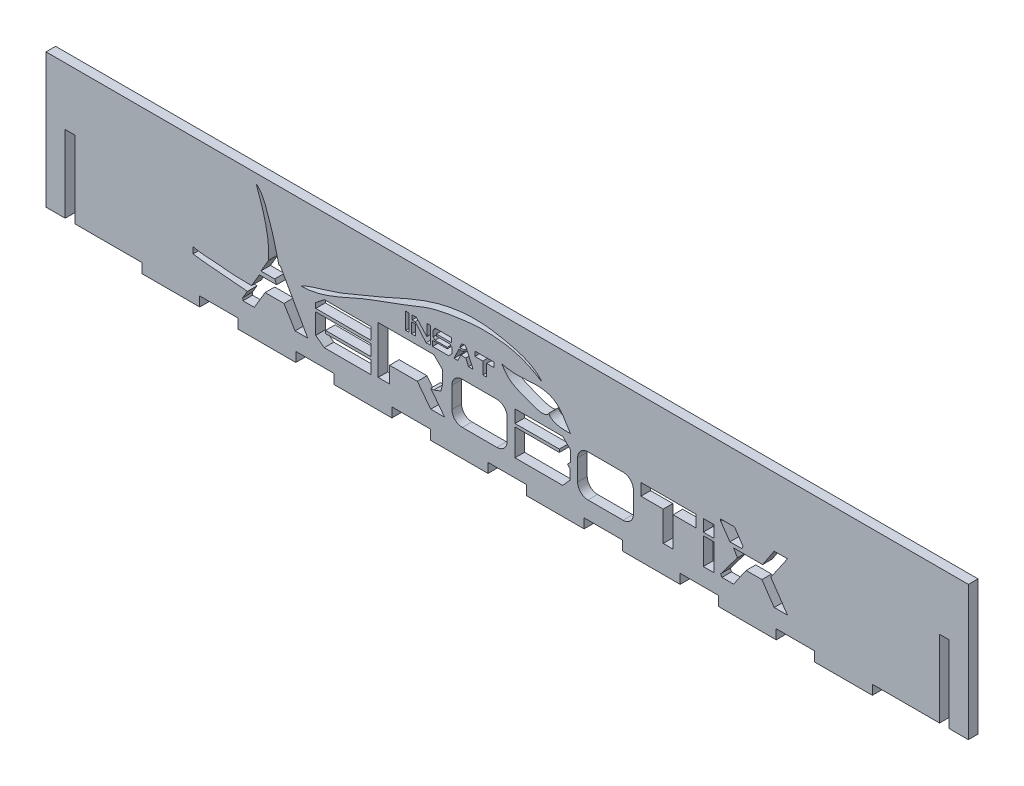
from build123d import *

# Parameters (mm, degrees)
SKETCH1_W           = 5.465631802
SKETCH1_H           = 13.937676678
SKETCH1_H_2         = 6.195408131
SKETCH1_W_2         = 2.126575518
SKETCH1_H_3         = 5.478126352
SKETCH1_W_3         = 1.826673842
SKETCH1_H_4         = 8.695253417
BOSS_EXTRUDE1_DEPTH = 5


with BuildPart() as part:
    # Sketch1 → Boss-Extrude1 (new body)
    with BuildSketch(Plane.XY):
        Polygon((-5.246535477, -61.546798422), (14.753464523, -61.546798422), (14.753464523, -66.546798422), (44.753464523, -66.546798422), (44.753464523, -61.546798422), (79.753464523, -61.546798422), (79.753464523, -21.546798422), (84.753464523, -21.546798422), (84.753464523, -61.546798422), (94.753464523, -61.546798422), (94.753464523, 8.453201578), (43.214989523, 8.453201578), (-333.708060477, 8.453201578), (-385.246535477, 8.453201578), (-385.246535477, -61.546798422), (-375.246535477, -61.546798422), (-375.246535477, -21.546798422), (-370.246535477, -21.546798422), (-370.246535477, -61.546798422), (-335.246535477, -61.546798422), (-335.246535477, -66.546798422), (-305.246535477, -66.546798422), (-305.246535477, -61.546798422), (-285.246535477, -61.546798422), (-285.246535477, -66.546798422), (-255.246535477, -66.546798422), (-255.246535477, -61.546798422), (-235.246535477, -61.546798422), (-235.246535477, -66.546798422), (-205.246535477, -66.546798422), (-205.246535477, -61.546798422), (-185.246535477, -61.546798422), (-185.246535477, -66.546798422), (-155.246535477, -66.546798422), (-155.246535477, -61.546798422), (-135.246535477, -61.546798422), (-135.246535477, -66.546798422), (-105.246535477, -66.546798422), (-105.246535477, -61.546798422), (-85.246535477, -61.546798422), (-85.246535477, -66.546798422), (-55.246535477, -66.546798422), (-55.246535477, -61.546798422), (-35.246535477, -61.546798422), (-35.246535477, -66.546798422), (-5.246535477, -66.546798422), align=None)
        Polygon((-244.885458777, -38.548907386), (-216.065747737, -38.548907386), (-216.065747737, -44.357102509), (-239.796373526, -44.357102509), (-239.796373526, -45.795322254), (-216.065747737, -45.795322254), (-216.065747737, -52.486584064), (-240.460167254, -52.486584064), (-244.885458777, -49.140953159), align=None, mode=Mode.SUBTRACT)
        Polygon((-185.044834002, -43.019238438), (-177.819483483, -52.486584064), (-185.044834002, -52.486584064), (-191.990038561, -43.38631248), (-206.452807588, -43.38631248), (-206.452807588, -51.83698087), (-212.374161985, -51.83698087), (-212.374161985, -36.535342305), (-212.374161985, -34.393641474), (-212.374161985, -27.096681916), (-183.405074323, -27.096681916), (-178.96042996, -31.541326278), (-178.96042996, -38.548907386), (-179.761163925, -41.66718781), (-183.405074323, -43.019238438), align=None, mode=Mode.SUBTRACT)
        with BuildLine():
            Line((-145.246535477, -36.189262222), (-145.246535477, -47.101969064))
            ThreePointArc((-145.246535477, -47.101969064), (-146.823652697, -50.909466844), (-150.631150477, -52.486584064))
            Line((-150.631150477, -52.486584064), (-168.615474882, -52.486584064))
            ThreePointArc((-168.615474882, -52.486584064), (-172.422972663, -50.909466844), (-174.000089882, -47.101969064))
            Line((-174.000089882, -47.101969064), (-174.000089882, -36.189262222))
            ThreePointArc((-174.000089882, -36.189262222), (-172.422972663, -32.381764441), (-168.615474882, -30.804647222))
            Line((-168.615474882, -30.804647222), (-150.631150477, -30.804647222))
            ThreePointArc((-150.631150477, -30.804647222), (-146.823652697, -32.381764441), (-145.246535477, -36.189262222))
        make_face(mode=Mode.SUBTRACT)
        Polygon((-240.460167254, -30.804647222), (-216.065747737, -30.804647222), (-216.065747737, -37.000055353), (-244.885458777, -37.000055353), (-244.885458777, -34.393641474), align=None, mode=Mode.SUBTRACT)
        Polygon((-116.333189716, -52.486584064), (-141.187337961, -52.486584064), (-141.187337961, -38.548907386), (-118.132156637, -38.548907386), (-118.132156637, -37.000055353), (-141.187337961, -37.000055353), (-141.187337961, -30.415091867), (-116.333189716, -30.415091867), (-112.354640109, -34.393641474), (-112.354640109, -40.087451274), (-113.934376645, -41.66718781), (-112.498549701, -43.103014754), (-112.498549701, -48.133575295), align=None, mode=Mode.SUBTRACT)
        with BuildLine():
            Line((-108.605218189, -47.101969064), (-108.605218189, -36.189262222))
            ThreePointArc((-108.605218189, -36.189262222), (-107.02810097, -32.381764441), (-103.220603189, -30.804647222))
            Line((-103.220603189, -30.804647222), (-84.948124135, -30.804647222))
            ThreePointArc((-84.948124135, -30.804647222), (-81.140626355, -32.381764441), (-79.563509135, -36.189262222))
            Line((-79.563509135, -36.189262222), (-79.563509135, -47.101969064))
            ThreePointArc((-79.563509135, -47.101969064), (-81.140626355, -50.909466844), (-84.948124135, -52.486584064))
            Line((-84.948124135, -52.486584064), (-103.220603189, -52.486584064))
            ThreePointArc((-103.220603189, -52.486584064), (-107.02810097, -50.909466844), (-108.605218189, -47.101969064))
        make_face(mode=Mode.SUBTRACT)
        with Locations((-40.483278974, -45.517745725)):
            Rectangle(SKETCH1_W, SKETCH1_H, mode=Mode.SUBTRACT)
        Polygon((-58.93059069, -52.486584064), (-64.04654943, -52.486584064), (-64.04654943, -37.000055353), (-75.669212976, -37.000055353), (-75.669212976, -30.804647222), (-47.074102995, -30.804647222), (-47.074102995, -37.000055353), (-58.93059069, -37.000055353), align=None, mode=Mode.SUBTRACT)
        with Locations((-40.483278974, -33.902351288)):
            Rectangle(SKETCH1_W, SKETCH1_H_2, mode=Mode.SUBTRACT)
        Polygon((-22.571923718, -32.950315198), (-23.105020443, -34.393641474), (-29.342252121, -34.393641474), (-34.140122642, -27.570656088), (-34.140122642, -26.510341907), (-26.945773159, -26.510341907), align=None, mode=Mode.SUBTRACT)
        Polygon((-25.450646031, -39.692362853), (-27.423103912, -36.189262222), (-12.336466606, -36.189262222), (-6.312473617, -27.096681916), (0.617783802, -27.096681916), (-8.071692809, -39.692362853), (0.617783802, -52.486584064), (-6.312473617, -52.486584064), (-12.685531008, -43.103014754), (-20.928471513, -43.103014754), (-27.423103912, -52.517197123), (-33.500406573, -52.517197123), (-34.140122642, -51.213717376), align=None, mode=Mode.SUBTRACT)
        with BuildLine():
            Line((-308.738514988, -44.357102509), (-308.738514988, -41.079291122))
            add(Edge.make_bspline(
                [(-278.259921557, -43.38631248), (-282.164616314, -43.47948511), (-288.805048272, -43.213641102), (-298.949654568, -42.150466532), (-305.254421491, -41.957095594), (-308.738514988, -41.079291122)],
                knots=[0, 0, 0, 0, 0.382817473, 0.650677062, 1, 1, 1, 1], degree=3))
            Line((-278.259921557, -43.38631248), (-277.244819371, -41.66718781))
            Line((-277.244819371, -41.66718781), (-274.214586787, -36.535342305))
            Line((-274.214586787, -36.535342305), (-265.243467917, -36.535342305))
            Line((-265.243467917, -36.535342305), (-266.243580538, -34.393641474))
            Line((-266.243580538, -34.393641474), (-273.426207545, -34.393641474))
            Line((-273.426207545, -34.393641474), (-269.397397127, -27.570656088))
            add(Edge.make_bspline(
                [(-275.939246748, 3.798697698), (-273.670051376, -2.130645576), (-270.191249055, -12.389740778), (-269.133179137, -23.171853792), (-269.397397127, -27.570656088)],
                knots=[0, 0, 0, 0, 0.591155901, 1, 1, 1, 1], degree=3))
            add(Edge.make_bspline(
                [(-264.037976131, -27.096681916), (-265.274342256, -22.923650228), (-266.472173779, -16.425416147), (-269.811862643, -7.145864435), (-271.916984627, -0.463887563), (-274.952287591, 2.979513405), (-275.939246748, 3.798697698)],
                knots=[0, 0, 0, 0, 0.388210244, 0.583926752, 0.882923019, 0.993986897, 0.993986897, 0.993986897, 0.993986897], degree=3))
            Line((-264.037976131, -27.096681916), (-263.288815161, -27.096681916))
            Line((-263.288815161, -27.096681916), (-249.037864977, -52.486584064))
            Line((-249.037864977, -52.486584064), (-255.609133606, -52.486584064))
            Line((-255.609133606, -52.486584064), (-261.422178933, -43.019238438))
            Line((-261.422178933, -43.019238438), (-271.23619737, -43.019238438))
            Line((-271.23619737, -43.019238438), (-276.826439549, -52.486584064))
            Line((-276.826439549, -52.486584064), (-282.765520468, -52.486584064))
            Line((-282.765520468, -52.486584064), (-282.881817782, -51.213717376))
            Line((-282.881817782, -51.213717376), (-280.453928302, -47.101969064))
            add(Edge.make_bspline(
                [(-308.738514988, -44.357102509), (-304.215946378, -45.082825896), (-294.768192068, -45.809647297), (-285.326102597, -46.582024035), (-280.453928302, -47.101969064)],
                knots=[0, 0, 0, 0, 0.482839298, 1, 1, 1, 1], degree=3))
        make_face(mode=Mode.SUBTRACT)
        with Locations((-193.936706974, -20.767331089)):
            Rectangle(SKETCH1_W_2, SKETCH1_H_3, mode=Mode.SUBTRACT)
        with Locations((-197.167465934, -19.158767557)):
            Rectangle(SKETCH1_W_3, SKETCH1_H_4, mode=Mode.SUBTRACT)
        Polygon((-193.091529525, -17.128562886), (-194.727356846, -17.128562886), (-194.727356846, -14.811140848), (-192.529575332, -14.811140848), (-187.038968436, -20.781910571), (-187.038968436, -14.811140848), (-185.044834002, -14.811140848), (-185.044834002, -23.726399749), (-187.475189055, -23.726399749), align=None, mode=Mode.SUBTRACT)
        Polygon((-182.119331955, -18.108929789), (-175.138231116, -18.108929789), (-174.096777867, -19.083285188), (-174.000089882, -21.988064918), (-175.626428778, -23.726399749), (-184.07793498, -23.726399749), (-184.07793498, -20.990918059), (-176.442763056, -20.990918059), (-176.442763056, -20.29333342), (-182.816916594, -20.29333342), (-183.809633196, -19.300616818), (-183.809633196, -16.241976478), (-182.816916594, -14.811140848), (-174.311750035, -14.811140848), (-174.311750035, -17.128562886), (-182.119331955, -17.128562886), align=None, mode=Mode.SUBTRACT)
        with BuildLine():
            add(Edge.make_bspline(
                [(-252.810012832, -30.804647222), (-240.761311193, -30.547634642), (-224.444532857, -20.919640313), (-201.946870412, -13.974168056), (-186.04251945, -6.726897641), (-171.956565087, -4.216797974), (-160.347163185, -2.897460714), (-150.544446675, -3.127758359), (-139.431781866, -4.709037122), (-131.367622064, -8.581572726), (-126.986944724, -11.383298774)],
                knots=[0, 0, 0, 0, 0.263229203, 0.423654277, 0.534863209, 0.658762998, 0.746701663, 0.800186565, 0.881407477, 1, 1, 1, 1], degree=3))
            add(Edge.make_bspline(
                [(-126.986944724, -11.383298774), (-131.485164457, -5.985353694), (-142.601657472, -2.67396248), (-160.781169403, 0.534342884), (-177.278897597, -1.412227822), (-194.367404713, -7.216944262), (-206.768651993, -13.226331897), (-221.313756236, -19.139902892), (-235.311793762, -25.468002369), (-247.479256216, -28.074035805), (-252.810012832, -30.804647222)],
                knots=[0, 0, 0, 0, 0.150329272, 0.252439192, 0.414342465, 0.51479867, 0.656699834, 0.722771244, 0.867027482, 1, 1, 1, 1], degree=3))
        make_face(mode=Mode.SUBTRACT)
        Polygon((-172.897935325, -23.506394265), (-170.377502068, -18.108929789), (-167.68086525, -18.108929789), (-167.68086525, -17.128562886), (-169.971286258, -17.128562886), (-168.826075754, -14.811140848), (-166.917391581, -14.811140848), (-163.004589025, -23.506394265), (-165.358632839, -23.506394265), (-166.804487501, -20.29333342), (-169.398681006, -20.29333342), (-170.986493226, -23.506394265), align=None, mode=Mode.SUBTRACT)
        Polygon((-157.921144393, -17.214009594), (-162.059584538, -17.214009594), (-162.059584538, -14.811140848), (-152.01217156, -14.811140848), (-152.01217156, -17.299456301), (-155.930502299, -17.299456301), (-155.930502299, -23.506394265), (-157.921144393, -23.506394265), align=None, mode=Mode.SUBTRACT)
        with BuildLine():
            add(Edge.make_bspline(
                [(-148.118586204, -13.430010584), (-147.036410904, -15.262857009), (-143.863086692, -19.858693705), (-136.155682176, -22.338494929), (-129.697856144, -25.290406395), (-124.419074752, -25.585256219), (-123.527124019, -23.506394265)],
                knots=[0, 0, 0, 0, 0.222563293, 0.555789363, 0.790592126, 1, 1, 1, 1], degree=3))
            add(Edge.make_bspline(
                [(-112.354640109, -27.096681916), (-114.710477583, -23.504777125), (-117.743991871, -16.878795217), (-127.465809121, -13.646006498), (-136.813691318, -14.673137844), (-144.260320835, -14.704261773), (-148.118586204, -13.430010584)],
                knots=[0, 0, 0, 0, 0.326564049, 0.464230744, 0.711527701, 1, 1, 1, 1], degree=3))
            add(Edge.make_bspline(
                [(-123.527124019, -23.506394265), (-123.163522072, -24.957491443), (-119.348861342, -27.171347306), (-115.132549075, -27.25553602), (-112.354640109, -27.096681916)],
                knots=[0, 0, 0, 0, 0.328241756, 1, 1, 1, 1], degree=3))
        make_face(mode=Mode.SUBTRACT)
    extrude(amount=BOSS_EXTRUDE1_DEPTH)


solid = part.part
